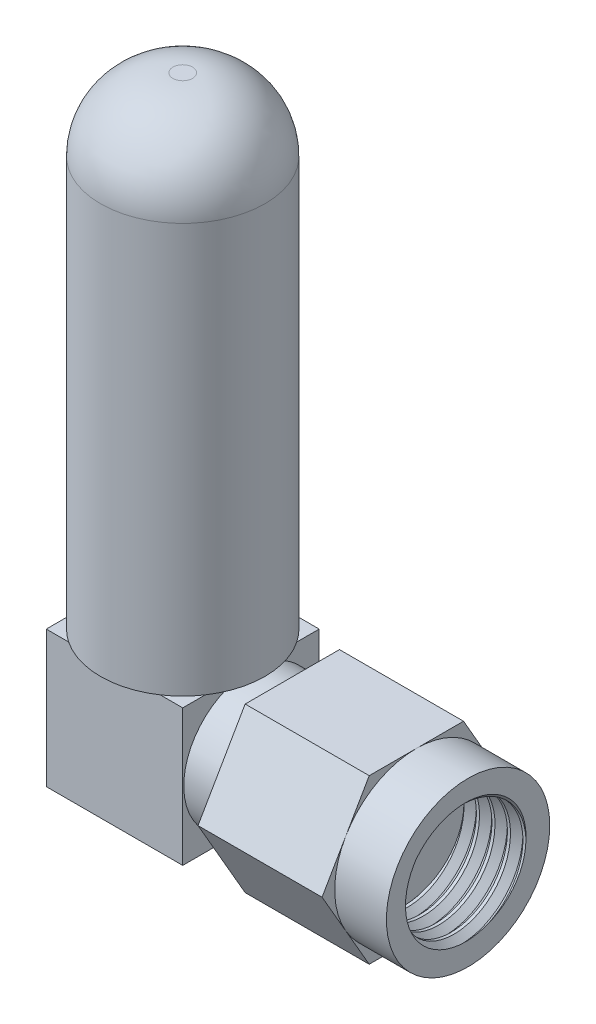
from build123d import *

# Parameters (mm, degrees)
SKETCH1_W           = 6.6
SKETCH1_H           = 6.6
BOSS_EXTRUDE1_DEPTH = 3.3
SKETCH2_R           = 3.25
BOSS_EXTRUDE2_DEPTH = 2
BOSS_EXTRUDE3_DEPTH = 6
SKETCH4_R           = 3.95
BOSS_EXTRUDE4_DEPTH = 2.5
SKETCH5_R           = 2.8
CUT_EXTRUDE1_DEPTH  = 3
SKETCH6_R           = 3.975
BOSS_EXTRUDE5_DEPTH = 23.3
FILLET1_R           = 3.5
CUT_SWEEP1_PITCH    = 0.75
CUT_SWEEP1_FROM     = 0


with BuildPart() as part:
    # Sketch1 → Boss-Extrude1 (new, symmetric)
    with BuildSketch(Plane.XY):
        Rectangle(SKETCH1_W, SKETCH1_H)
    extrude(amount=BOSS_EXTRUDE1_DEPTH, both=True)

    # Sketch2 → Boss-Extrude2 (add)
    with BuildSketch(Plane(origin=(3.3, 0, 0), x_dir=(0, 0, -1), z_dir=(1, 0, 0))):
        with Locations(Location((0, 0, 0), (0, 0, 90))):
            Circle(SKETCH2_R)
    extrude(amount=BOSS_EXTRUDE2_DEPTH)

    # Sketch3 → Boss-Extrude3 (add)
    with BuildSketch(Plane(origin=(5.3, 0, 0), x_dir=(0, 0, -1), z_dir=(1, 0, 0))):
        Polygon((4.561067127, 0), (2.280533563, 3.95), (-2.280533563, 3.95), (-4.561067127, 0), (-2.280533563, -3.95), (2.280533563, -3.95), align=None)
    extrude(amount=BOSS_EXTRUDE3_DEPTH)

    # Sketch4 → Boss-Extrude4 (add)
    with BuildSketch(Plane(origin=(11.3, 0, 0), x_dir=(0, 0, -1), z_dir=(1, 0, 0))):
        with Locations(Location((0, 0, 0), (0, 0, 150))):
            Circle(SKETCH4_R)
    extrude(amount=BOSS_EXTRUDE4_DEPTH)

    # Sketch5 → Cut-Extrude1 (cut)
    with BuildSketch(Plane(origin=(13.8, 0, 0), x_dir=(0, 0, -1), z_dir=(1, 0, 0))):
        Circle(SKETCH5_R)
    extrude(amount=-CUT_EXTRUDE1_DEPTH, mode=Mode.SUBTRACT)

    # Sketch6 → Boss-Extrude5 (add)
    with BuildSketch(Plane(origin=(0, 3.3, 0), x_dir=(1, 0, 0), z_dir=(0, 1, 0))):
        with Locations(Location((0, 0, 0), (0, 0, 326.118124803))):
            Circle(SKETCH6_R)
    extrude(amount=BOSS_EXTRUDE5_DEPTH)

    # Fillet1
    fillet1_edges = [part.edges().sort_by_distance(p)[0] for p in [
        (-3.3, 26.6, -2.215993005),
    ]]
    fillet(fillet1_edges, radius=FILLET1_R)

    # Cut-Sweep1: arcs per turn and ends read off the stored shape
    # Cut-Sweep1: the profile of Sketch9 profile screwed along a left-hand helix through 10 turns, 8 arcs to a turn; built about Z, then put on its axis
    cut_sweep1_z = Axis((0, 0, 0), (0, 0, 1))
    cut_sweep1_corners = [(2.7997, 0, -0.1497), (2.7997, 0, -0.7503), (3.1, 0, -0.45)]
    with BuildLine(mode=Mode.PRIVATE) as cut_sweep1_profile:
        Line(cut_sweep1_corners[0], cut_sweep1_corners[1])
        Line(cut_sweep1_corners[1], cut_sweep1_corners[2])
        Line(cut_sweep1_corners[2], cut_sweep1_corners[0])
    cut_sweep1_cap = Face(cut_sweep1_profile.wire())
    cut_sweep1_turn_angles = [0, -22.5, -45, -67.5, -90, -112.5, -135, -157.5, -180, -202.5, -225, -247.5, -270, -292.5, -315, -337.5, -360]
    cut_sweep1_turn_weights = [1, 0.9238795325112867, 1, 0.9238795325112867, 1, 0.9238795325112867, 1, 0.9238795325112867, 1, 0.9238795325112867, 1, 0.9238795325112867, 1, 0.9238795325112867, 1, 0.9238795325112867, 1]
    cut_sweep1_turn_rails = [Edge.make_bspline([Vector(p[0], p[1], 0).rotate(cut_sweep1_z, cut_sweep1_turn_angles[k]) / cut_sweep1_turn_weights[k] + Vector(0, 0, p[2] + -CUT_SWEEP1_PITCH * cut_sweep1_turn_angles[k] / 360) for k in range(17)], [0, 0, 0, 1, 1, 2, 2, 3, 3, 4, 4, 5, 5, 6, 6, 7, 7, 8, 8, 8], 2, cut_sweep1_turn_weights) for p in cut_sweep1_corners]
    cut_sweep1_turn_sides = [Face.make_surface_from_curves(cut_sweep1_turn_rails[p[0]], cut_sweep1_turn_rails[p[1]]) for p in [(0, 1), (1, 2), (2, 0)]]
    cut_sweep1 = Plane(origin=(10.8, 0, 0), x_dir=(0, 0, -1), z_dir=(1, 0, 0)) * split(Solid(Shell([*[p.moved(Location((0, 0, CUT_SWEEP1_PITCH * i))) for i in range(10) for p in cut_sweep1_turn_sides], cut_sweep1_cap, cut_sweep1_cap.rotate(cut_sweep1_z, -3600).moved(Location((0, 0, -CUT_SWEEP1_PITCH * -3600 / 360)))])), bisect_by=Plane.XY.offset(CUT_SWEEP1_FROM), keep=Keep.TOP, mode=Mode.PRIVATE)
    add(cut_sweep1, mode=Mode.SUBTRACT)


solid = part.part
